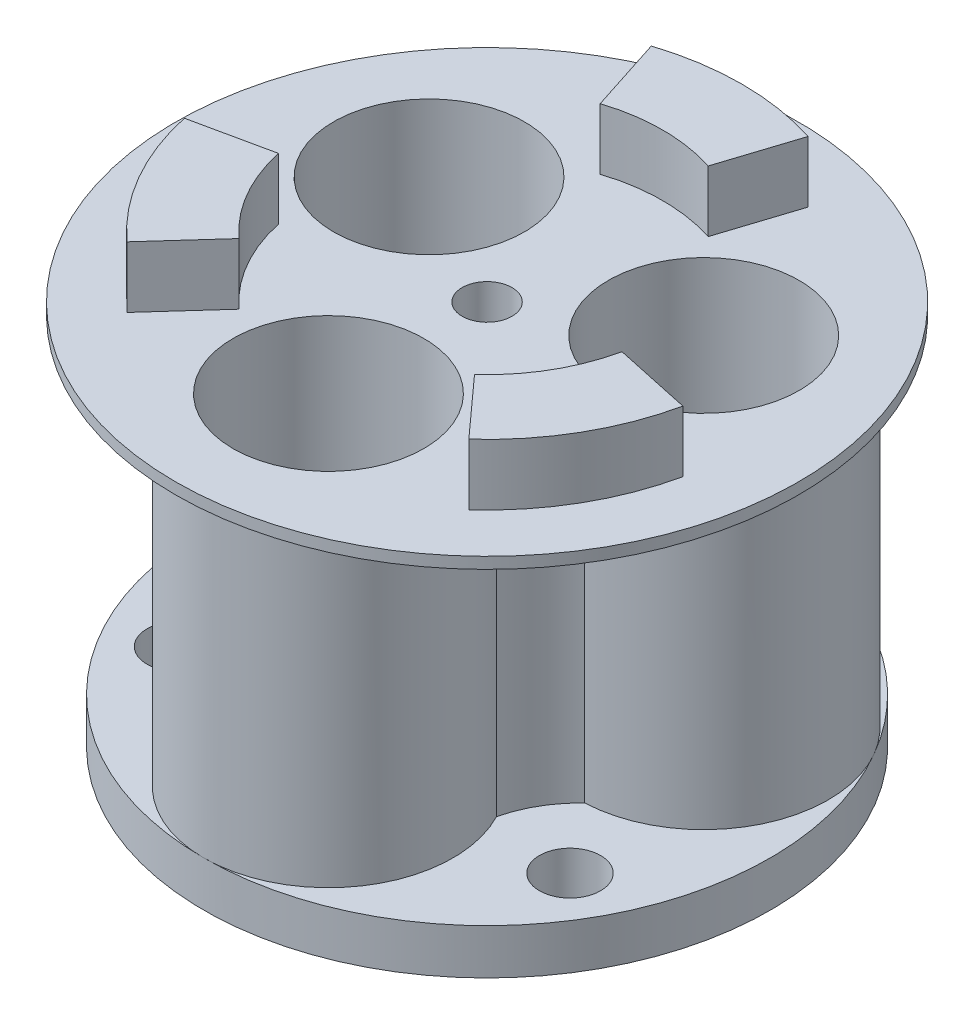
from build123d import *

# Parameters (mm, degrees)
SKETCH1_R           = 27.5
SKETCH1_R_2         = 2.2
SKETCH1_R_3         = 8.425
BOSS_EXTRUDE1_DEPTH = 34
BOSS_EXTRUDE2_DEPTH = 5.4
SKETCH5_R           = 40.989273042
CUT_EXTRUDE1_DEPTH  = 29
SKETCH6_R           = 2.7
CUT_EXTRUDE2_DEPTH  = 5
SKETCH7_R           = 33.756466266
SKETCH7_R_2         = 25
CUT_EXTRUDE6_DEPTH  = 4


with BuildPart() as part:
    # Sketch1 → Boss-Extrude1 (new body)
    with BuildSketch(Plane(origin=(0, 0, 0), x_dir=(1, 0, 0), z_dir=(0, 1, 0))):
        Circle(SKETCH1_R)
        Circle(SKETCH1_R_2, mode=Mode.SUBTRACT)
        with Locations((0, -14)):
            Circle(SKETCH1_R_3, mode=Mode.SUBTRACT)
        with Locations((-12.124355653, 7)):
            Circle(SKETCH1_R_3, mode=Mode.SUBTRACT)
        with Locations((12.124355653, 7)):
            Circle(SKETCH1_R_3, mode=Mode.SUBTRACT)
    extrude(amount=BOSS_EXTRUDE1_DEPTH)

    # Sketch4 → Boss-Extrude2 (add)
    with BuildSketch(Plane(origin=(0, 34, 0), x_dir=(1, 0, 0), z_dir=(0, 1, 0))):
        with BuildLine():
            ThreePointArc((15.15564017, -3.249087725), (13.423393759, -7.75), (10.391612594, -11.500625535))
            Line((10.391612594, -11.500625535), (15.084598927, -16.694456422))
            ThreePointArc((15.084598927, -16.694456422), (19.485571585, -11.25), (22.000122827, -4.716417665))
            Line((22.000122827, -4.716417665), (15.15564017, -3.249087725))
        make_face()
        with BuildLine():
            Line((-15.084598927, -16.694456422), (-10.391612594, -11.500625535))
            ThreePointArc((-10.391612594, -11.500625535), (-13.423393759, -7.75), (-15.15564017, -3.249087725))
            Line((-15.15564017, -3.249087725), (-22.000122827, -4.716417665))
            ThreePointArc((-22.000122827, -4.716417665), (-19.485571585, -11.25), (-15.084598927, -16.694456422))
        make_face()
        with BuildLine():
            ThreePointArc((-4.764027576, 14.74971326), (0, 15.5), (4.764027576, 14.74971326))
            Line((4.764027576, 14.74971326), (6.9155239, 21.410874087))
            ThreePointArc((6.9155239, 21.410874087), (0, 22.5), (-6.9155239, 21.410874087))
            Line((-6.9155239, 21.410874087), (-4.764027576, 14.74971326))
        make_face()
    extrude(amount=BOSS_EXTRUDE2_DEPTH)

    # Sketch5 → Cut-Extrude1 (cut)
    with BuildSketch(Plane(origin=(0, 4, 0), x_dir=(1, 0, 0), z_dir=(0, 1, 0))):
        Circle(SKETCH5_R)
        with BuildLine():
            ThreePointArc((-2.849843175, 12.914678207), (0, 12.5), (2.849843175, 12.914678207))
            ThreePointArc((2.849843175, 12.914678207), (21.650635095, 12.5), (12.609360996, -3.989302517))
            ThreePointArc((12.609360996, -3.989302517), (10.825317547, -6.25), (9.759517821, -8.925375689))
            ThreePointArc((9.759517821, -8.925375689), (0, -25), (-9.759517821, -8.925375689))
            ThreePointArc((-9.759517821, -8.925375689), (-10.825317547, -6.25), (-12.609360996, -3.989302517))
            ThreePointArc((-12.609360996, -3.989302517), (-21.650635095, 12.5), (-2.849843175, 12.914678207))
        make_face(mode=Mode.SUBTRACT)
    extrude(amount=CUT_EXTRUDE1_DEPTH, mode=Mode.SUBTRACT)

    # Sketch6 → Cut-Extrude2 (cut)
    with BuildSketch(Plane.XZ):
        with Locations((0, -20)):
            Circle(SKETCH6_R)
        with Locations((-17.320508076, 10)):
            Circle(SKETCH6_R)
        with Locations((17.320508076, 10)):
            Circle(SKETCH6_R)
    extrude(amount=-CUT_EXTRUDE2_DEPTH, mode=Mode.SUBTRACT)

    # Sketch7 → Cut-Extrude6 (cut)
    with BuildSketch(Plane.XZ):
        Circle(SKETCH7_R)
        Circle(SKETCH7_R_2, mode=Mode.SUBTRACT)
    extrude(amount=-CUT_EXTRUDE6_DEPTH, mode=Mode.SUBTRACT)


solid = part.part
